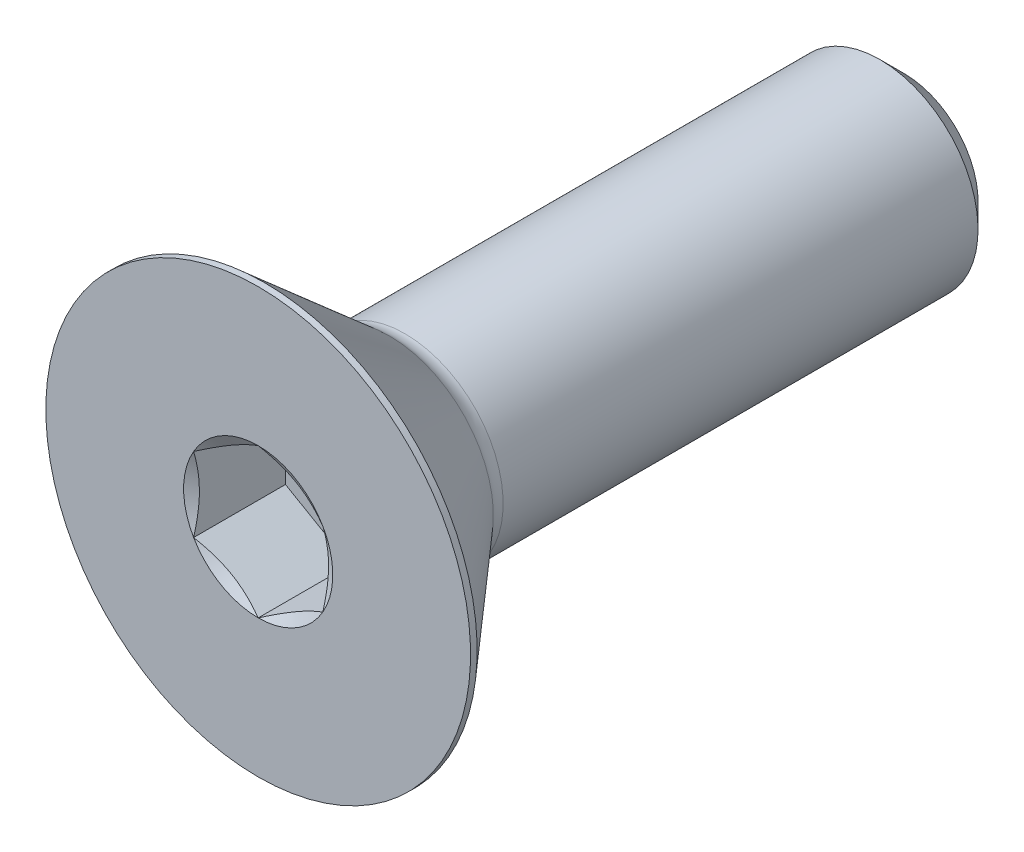
from build123d import *

# Parameters (mm, degrees)
SKETCH1_W          = 15.875
SKETCH1_H          = 2.413
CHAMFER1_SIZE      = 0.5953125
CUT_EXTRUDE2_DEPTH = 2.25806


with BuildPart() as part:
    # Sketch1 → Revolve1 (revolve)
    with BuildSketch(Plane(origin=(0, 0, 0), x_dir=(0, 0, -1), z_dir=(1, 0, 0))):
        with Locations((7.9375, 1.2065)):
            Rectangle(SKETCH1_W, SKETCH1_H)
    revolve(axis=Axis((0, 0, -15.875), (0, 0, 1)))

    # Chamfer1
    chamfer1_edges = [part.edges().sort_by_distance(p)[0] for p in [
        (0, -2.413, -15.875),
    ]]
    chamfer(chamfer1_edges, length=CHAMFER1_SIZE)

    # Sketch7 → Revolve2 (revolve)
    with BuildSketch(Plane(origin=(0, 0, 0), x_dir=(0, 0, -1), z_dir=(1, 0, 0))):
        with BuildLine():
            Line((0, 5.2197), (0.16129, 5.2197))
            Line((0.16129, 5.2197), (3.2258, 2.555762099))
            ThreePointArc((3.2258, 2.555762099), (3.403809493, 2.44985758), (3.607634579, 2.413))
            Line((3.607634579, 2.413), (3.607634579, 0))
            Line((3.607634579, 0), (0, 0))
            Line((0, 0), (0, 5.2197))
        make_face()
    revolve(axis=Axis((0, 0, 0), (0, 0, -1)))

    # Sketch5 → Cut-Extrude2 (cut)
    with BuildSketch(Plane.XY):
        Polygon((0, 1.833087105), (-1.5875, 0.916543552), (-1.5875, -0.916543552), (0, -1.833087105), (1.5875, -0.916543552), (1.5875, 0.916543552), align=None)
    extrude(amount=-CUT_EXTRUDE2_DEPTH, mode=Mode.SUBTRACT)

    # Cut-Extrude3 cone 1 section (through the dimple's axis) → Cut-Extrude3 (revolve, cut)
    with BuildSketch(Plane(origin=(0, 0, 0), x_dir=(0, -1, 0), z_dir=(1, 0, 0))):
        Polygon((0, 0), (1.833087105, 0), (0, 1.058333333), align=None)
    revolve(axis=Axis((0, 0, 0), (0, 0, -1)), mode=Mode.SUBTRACT)


solid = part.part
